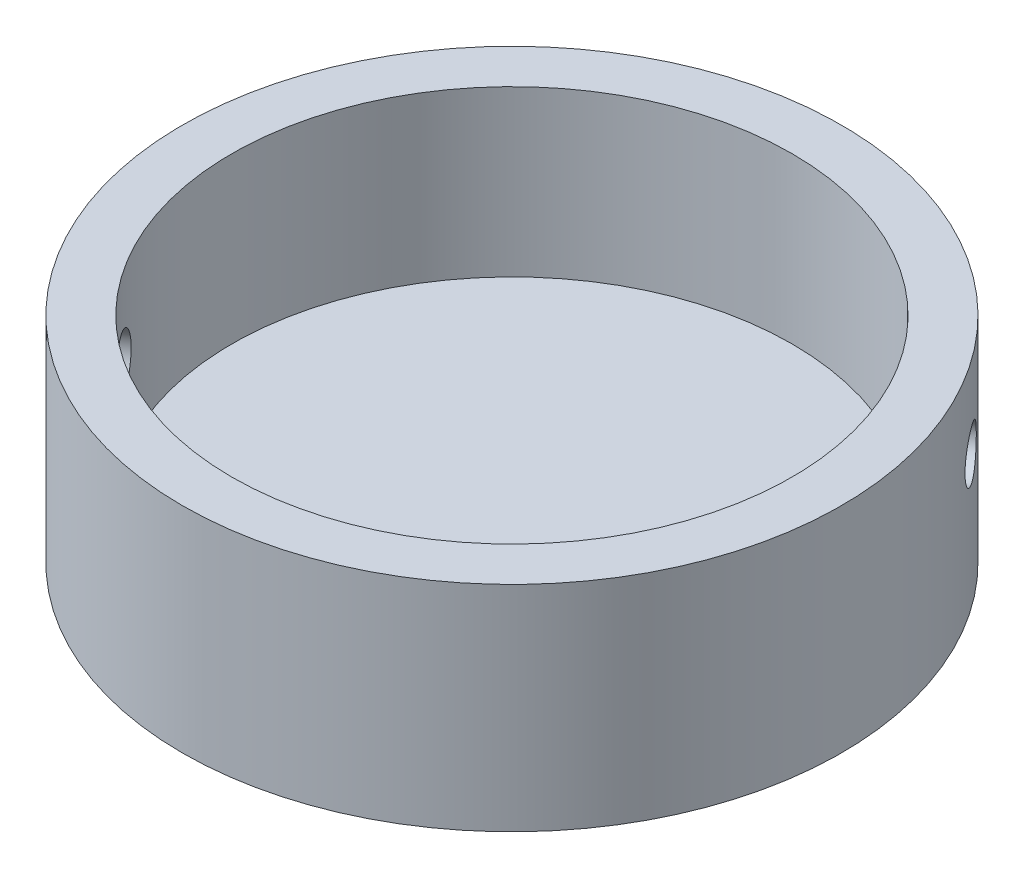
from build123d import *

# Parameters (mm, degrees)
SKETCH1_R              = 20
BOSS_EXTRUDE2_DEPTH    = 8
SKETCH7_R              = 20
BOSS_EXTRUDE3_DEPTH    = 5
CUT_EXTRUDE2_START     = -20.000000091
CUT_EXTRUDE2_OUTLINE_R = 2
CUT_EXTRUDE2_DEPTH     = 20.00000009
SKETCH14_R             = 1.5
CUT_EXTRUDE3_DEPTH     = 25
SKETCH15_R             = 17
CUT_EXTRUDE4_DEPTH     = 10


# Read off the part's stored shape, not the designer's step: Cut-Extrude2
with BuildPart() as part:
    # Sketch1 → Boss-Extrude2 (new body)
    with BuildSketch(Plane(origin=(0, 0, 0), x_dir=(1, 0, 0), z_dir=(0, 1, 0))):
        with Locations(Location((0, 0, 0), (0, 0, 270))):
            Circle(SKETCH1_R)
    extrude(amount=BOSS_EXTRUDE2_DEPTH)

    # Sketch7 → Boss-Extrude3 (add)
    with BuildSketch(Plane(origin=(0, 8, 0), x_dir=(1, 0, 0), z_dir=(0, 1, 0))):
        with Locations(Location((0, 0, 0), (0, 0, 270))):
            Circle(SKETCH7_R)
    extrude(amount=BOSS_EXTRUDE3_DEPTH)

    # Cut-Extrude2 outline → Cut-Extrude2 (cut)
    with BuildSketch(Plane(origin=(0, 0, 0), x_dir=(0.5840722771163888, 0, 0.8117016539986083), z_dir=(0.8117016539986082, 0, -0.5840722771163891)).offset(CUT_EXTRUDE2_START)):
        with Locations((0, -8)):
            Circle(CUT_EXTRUDE2_OUTLINE_R)
    extrude(amount=CUT_EXTRUDE2_DEPTH, mode=Mode.SUBTRACT)

    # Sketch14 → Cut-Extrude3 (cut)
    with BuildSketch(Plane(origin=(0, 0, 0), x_dir=(0.5840722775801191, 0, 0.8117016536649241), z_dir=(-0.8117016536649241, 0, 0.5840722775801191))):
        with Locations((0, 8)):
            Circle(SKETCH14_R)
    extrude(amount=-CUT_EXTRUDE3_DEPTH, mode=Mode.SUBTRACT)

    # Sketch15 → Cut-Extrude4 (cut)
    with BuildSketch(Plane(origin=(0, 13, 0), x_dir=(1, 0, 0), z_dir=(0, 1, 0))):
        with Locations(Location((0, 0, 0), (0, 0, 270))):
            Circle(SKETCH15_R)
    extrude(amount=-CUT_EXTRUDE4_DEPTH, mode=Mode.SUBTRACT)


solid = part.part
